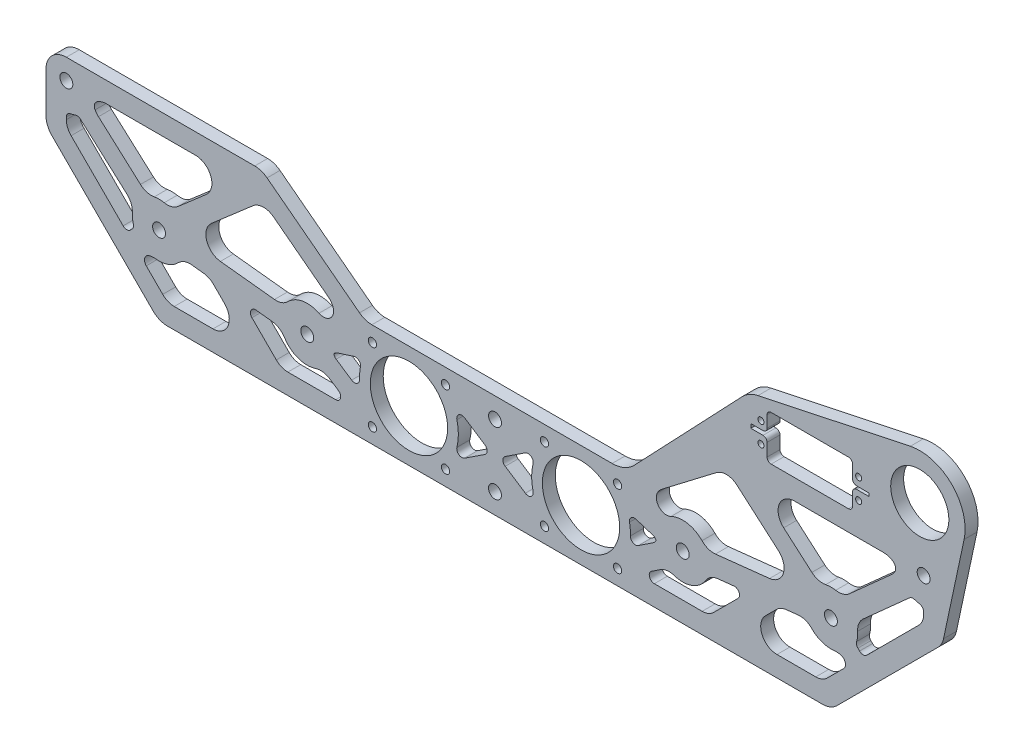
from build123d import *

# Parameters (mm, degrees)
SKETCH1_R           = 14.2875
SKETCH1_R_2         = 3.175
BOSS_EXTRUDE1_DEPTH = 6.35
FILLET1_R           = 10
CUT_EXTRUDE1_DEPTH  = 10
FILLET2_R           = 2.5
FILLET3_DEPTH       = 6.35
FILLET4_R           = 8
FILLET5_R           = 8
FILLET6_R           = 3
FILLET7_R           = 8
FILLET8_R           = 5
FILLET9_R           = 3
FILLET10_R          = 8
SKETCH3_R           = 19
CUT_EXTRUDE2_DEPTH  = 10
SKETCH4_R           = 2.032
CUT_EXTRUDE3_DEPTH  = 10
BOSS_EXTRUDE2_START = -6.35
SKETCH5_R           = 1.5
SKETCH5_R_2         = 14.2875
BOSS_EXTRUDE2_DEPTH = 6.35
FILLET11_R          = 2
FILLET12_R          = 15
SKETCH6_W           = 8
SKETCH6_H           = 1.5
SKETCH6_H_2         = 2.017189856
CUT_EXTRUDE4_DEPTH  = 10
FILLET13_R          = 2


with BuildPart() as part:
    # Sketch1 → Boss-Extrude1 (new body)
    with BuildSketch(Plane.XY):
        Polygon((-62.442934658, -37.279495554), (267.757065342, -37.279495554), (323.315335232, 18.278774336), (323.315335232, 52.320504446), (217.352871158, 52.320504446), (166.552871158, 13.520504446), (38.761259526, 13.520504446), (-12.038740474, 52.320504446), (-118.001204548, 52.320504446), (-118.001204548, 18.278774336), align=None)
        with Locations((60.373820223, -11.879495554)):
            Circle(SKETCH1_R, mode=Mode.SUBTRACT)
        with Locations((-62.442934658, 1.520504446)):
            Circle(SKETCH1_R_2, mode=Mode.SUBTRACT)
        with Locations((10.373820223, -6.424213816)):
            Circle(SKETCH1_R_2, mode=Mode.SUBTRACT)
        with Locations((102.657065342, -27.279495554)):
            Circle(SKETCH1_R_2, mode=Mode.SUBTRACT)
        with Locations((144.940310462, -11.879495554)):
            Circle(SKETCH1_R, mode=Mode.SUBTRACT)
        with Locations((194.940310462, -6.424213816)):
            Circle(SKETCH1_R_2, mode=Mode.SUBTRACT)
        with Locations((102.657065342, 3.520504446)):
            Circle(SKETCH1_R_2, mode=Mode.SUBTRACT)
        with Locations((267.757065342, 1.520504446)):
            Circle(SKETCH1_R_2, mode=Mode.SUBTRACT)
        with Locations((313.315335232, 42.320504446)):
            Circle(SKETCH1_R_2, mode=Mode.SUBTRACT)
        with Locations((-108.001204548, 42.320504446)):
            Circle(SKETCH1_R_2, mode=Mode.SUBTRACT)
    extrude(amount=BOSS_EXTRUDE1_DEPTH)

    # Fillet1
    fillet1_edges = [part.edges().sort_by_distance(p)[0] for p in [
        (-118.001204548, 18.278774336, 3.175),
        (-118.001204548, 52.320504446, 3.175),
        (-12.038740474, 52.320504446, 3.175),
        (38.761259526, 13.520504446, 3.175),
        (166.552871158, 13.520504446, 3.175),
        (217.352871158, 52.320504446, 3.175),
        (323.315335232, 52.320504446, 3.175),
        (323.315335232, 18.278774336, 3.175),
        (267.757065342, -37.279495554, 3.175),
        (-62.442934658, -37.279495554, 3.175),
    ]]
    fillet(fillet1_edges, radius=FILLET1_R)

    # Sketch2 → Cut-Extrude1 (cut)
    with BuildSketch(Plane.XY.offset(6.35)):
        with BuildLine():
            ThreePointArc((23.505920872, -7.486549706), (23.419545179, -8.265323632), (23.28702714, -9.037585605))
            Line((23.28702714, -9.037585605), (36.905820905, -18.135345959))
            ThreePointArc((36.905820905, -18.135345959), (36.127690836, -10.462503664), (37.794303215, -2.932536966))
            Line((37.794303215, -2.932536966), (23.505920872, -7.486549706))
        make_face()
        with BuildLine():
            Line((-74.858923583, 5.927753475), (-102.256554243, 30.463876853))
            ThreePointArc((-102.256554243, 30.463876853), (-105.054209768, 29.479326667), (-108.001204548, 29.145504446))
            Line((-108.001204548, 29.145504446), (-108.001204548, 22.42090996))
            Line((-108.001204548, 22.42090996), (-78.307400752, -7.272893836))
            Line((-78.307400752, -7.272893836), (-74.597651385, -3.563144469))
            ThreePointArc((-74.597651385, -3.563144469), (-75.612945288, 1.157951013), (-74.858923583, 5.927753475))
        make_face()
        with BuildLine():
            Line((-23.050139283, 42.320504446), (-94.826204548, 42.320504446))
            ThreePointArc((-94.826204548, 42.320504446), (-95.017343814, 40.084439722), (-95.585215622, 37.913255418))
            Line((-95.585215622, 37.913255418), (-68.187584962, 13.377132039))
            ThreePointArc((-68.187584962, 13.377132039), (-62.339595002, 14.695099162), (-56.512999229, 13.285558242))
            Line((-56.512999229, 13.285558242), (-23.050139283, 42.320504446))
        make_face()
        with BuildLine():
            Line((-67.526583573, -10.63421228), (-71.23633294, -14.343961648))
            Line((-71.23633294, -14.343961648), (-58.300799034, -27.279495554))
            Line((-58.300799034, -27.279495554), (-16.619224161, -27.279495554))
            Line((-16.619224161, -27.279495554), (-37.688728757, -6.209990957))
            Line((-37.688728757, -6.209990957), (-50.867789262, -4.772081195))
            ThreePointArc((-50.867789262, -4.772081195), (-58.069603335, -10.907471984), (-67.526583573, -10.63421228))
        make_face()
        with BuildLine():
            Line((30.003625706, 7.626245825), (-11.363222422, 39.221397545))
            Line((-11.363222422, 39.221397545), (-49.959338032, 5.732444651))
            ThreePointArc((-49.959338032, 5.732444651), (-49.868096719, 5.45167168), (-49.783169494, 5.168924788))
            Line((-49.783169494, 5.168924788), (-1.201325173, -0.131628174))
            ThreePointArc((-1.201325173, -0.131628174), (9.059387493, 6.685053578), (20.46921657, 2.041221648))
            Line((20.46921657, 2.041221648), (32.642653903, 5.921156225))
            ThreePointArc((32.642653903, 5.921156225), (31.289604918, 6.721797881), (30.003625706, 7.626245825))
        make_face()
        with BuildLine():
            Line((-21.814640677, -7.941943413), (-2.477088537, -27.279495554))
            Line((-2.477088537, -27.279495554), (32.591759865, -27.279495554))
            Line((32.591759865, -27.279495554), (17.732180345, -17.352853315))
            ThreePointArc((17.732180345, -17.352853315), (5.870863239, -18.805813204), (-2.285944941, -10.072634157))
            Line((-2.285944941, -10.072634157), (-21.814640677, -7.941943413))
        make_face()
        with BuildLine():
            Line((187.581950339, -17.352853315), (172.722370819, -27.279495554))
            Line((172.722370819, -27.279495554), (207.791219222, -27.279495554))
            Line((207.791219222, -27.279495554), (227.128771362, -7.941943413))
            Line((227.128771362, -7.941943413), (207.600075626, -10.072634157))
            ThreePointArc((207.600075626, -10.072634157), (199.443267446, -18.805813204), (187.581950339, -17.352853315))
        make_face()
        with BuildLine():
            Line((243.002859442, -6.209990957), (221.933354845, -27.279495554))
            Line((221.933354845, -27.279495554), (263.614929719, -27.279495554))
            Line((263.614929719, -27.279495554), (276.550463625, -14.343961648))
            Line((276.550463625, -14.343961648), (272.840714257, -10.63421228))
            ThreePointArc((272.840714257, -10.63421228), (263.38373402, -10.907471984), (256.181919946, -4.772081195))
            Line((256.181919946, -4.772081195), (243.002859442, -6.209990957))
        make_face()
        with BuildLine():
            Line((168.408309779, -18.135345959), (182.027103545, -9.037585605))
            ThreePointArc((182.027103545, -9.037585605), (181.894585505, -8.265323632), (181.808209813, -7.486549706))
            Line((181.808209813, -7.486549706), (167.519827469, -2.932536966))
            ThreePointArc((167.519827469, -2.932536966), (169.186439849, -10.462503664), (168.408309779, -18.135345959))
        make_face()
        with BuildLine():
            ThreePointArc((175.310504979, 7.626245825), (174.024525767, 6.721797881), (172.671476782, 5.921156225))
            Line((172.671476782, 5.921156225), (184.844914115, 2.041221648))
            ThreePointArc((184.844914115, 2.041221648), (196.254743191, 6.685053578), (206.515455858, -0.131628174))
            Line((206.515455858, -0.131628174), (255.097300178, 5.168924788))
            ThreePointArc((255.097300178, 5.168924788), (255.182227404, 5.45167168), (255.273468717, 5.732444651))
            Line((255.273468717, 5.732444651), (216.677353107, 39.221397545))
            Line((216.677353107, 39.221397545), (175.310504979, 7.626245825))
        make_face()
        with BuildLine():
            Line((279.911782069, -3.563144469), (283.621531436, -7.272893836))
            Line((283.621531436, -7.272893836), (313.315335232, 22.42090996))
            Line((313.315335232, 22.42090996), (313.315335232, 29.145504446))
            ThreePointArc((313.315335232, 29.145504446), (310.368340453, 29.479326667), (307.570684928, 30.463876853))
            Line((307.570684928, 30.463876853), (280.173054268, 5.927753475))
            ThreePointArc((280.173054268, 5.927753475), (280.927075973, 1.157951013), (279.911782069, -3.563144469))
        make_face()
        with BuildLine():
            Line((228.364269968, 42.320504446), (261.827129914, 13.285558242))
            ThreePointArc((261.827129914, 13.285558242), (267.653725687, 14.695099162), (273.501715647, 13.377132039))
            Line((273.501715647, 13.377132039), (300.899346307, 37.913255418))
            ThreePointArc((300.899346307, 37.913255418), (300.331474499, 40.084439722), (300.140335232, 42.320504446))
            Line((300.140335232, 42.320504446), (228.364269968, 42.320504446))
        make_face()
        with BuildLine():
            Line((124.499254422, 1.237130698), (104.481636284, -11.879495554))
            Line((104.481636284, -11.879495554), (124.499254422, -24.996121805))
            ThreePointArc((124.499254422, -24.996121805), (120.652810462, -11.879495554), (124.499254422, 1.237130698))
        make_face()
        with BuildLine():
            Line((100.832494401, -11.879495554), (80.814876263, 1.237130698))
            ThreePointArc((80.814876263, 1.237130698), (84.661320223, -11.879495554), (80.814876263, -24.996121805))
            Line((80.814876263, -24.996121805), (100.832494401, -11.879495554))
        make_face()
    extrude(amount=-CUT_EXTRUDE1_DEPTH, mode=Mode.SUBTRACT)

    # Fillet2
    # the kernel refuses this fillet: 2.5 mm, written as the material it adds along each edge
    with BuildSketch(Plane(origin=(124.499254422, -24.996121805, 6.35), x_dir=(-0.8364298099761919, 0.5480740579366914, 0), z_dir=(0, 0, -1)), Plane(origin=(80.814876263, 1.237130698, 6.35), x_dir=(0.8364298099761912, -0.5480740579366923, 0), z_dir=(0, 0, -1))) as fillet2_piece_1:
        with BuildLine():
            CenterArc((8.270761151, 2.5), FILLET2_R, 132.738385679, 137.261614321)
            ThreePointArc((6.574131455, 4.336150232), (3.463988922, 1.899838021), (0, 0))
            Line((0, 0), (8.270761151, 0))
        make_face()
    extrude(amount=6.35)
    with BuildSketch(Plane(origin=(104.481636284, -11.879495554, 6.35), x_dir=(0.836429809976191, 0.5480740579366925, 0), z_dir=(0, 0, -1)), Plane(origin=(100.832494401, -11.879495554, 6.35), x_dir=(-0.836429809976192, -0.5480740579366911, 0), z_dir=(0, 0, -1))) as fillet2_piece_2:
        with BuildLine():
            CenterArc((FILLET2_R * 1.52612552604, FILLET2_R), FILLET2_R, 156.469970738, 113.530029262)
            Line((FILLET2_R * 0.609274565772, FILLET2_R * 1.39922965403), (0, 0))
            Line((0, 0), (FILLET2_R * 1.52612552604, 0))
        make_face()
    extrude(amount=6.35)
    with BuildSketch(Plane(origin=(124.499254422, 1.237130698, 6.35), x_dir=(-0.8364298099761911, -0.5480740579366926, 0), z_dir=(0, 0, -1)), Plane(origin=(80.814876263, -24.996121805, 6.35), x_dir=(0.8364298099761913, 0.5480740579366921, 0), z_dir=(0, 0, -1))) as fillet2_piece_3:
        with BuildLine():
            CenterArc((8.270761151, -2.5), FILLET2_R, 90, 137.261614321)
            ThreePointArc((6.574131455, -4.336150232), (3.463988922, -1.899838021), (0, 0))
            Line((0, 0), (8.270761151, 0))
        make_face()
    extrude(amount=6.35)
    with BuildSketch(Plane(origin=(36.905820905, -18.135345959, 6.35), x_dir=(-0.8315267709778132, 0.5554846794891928, 0), z_dir=(0, 0, -1))) as fillet2_piece_4:
        with BuildLine():
            CenterArc((5.637586761, 2.5), FILLET2_R, 144.019234869, 125.980765131)
            ThreePointArc((3.614551073, 3.968784057), (1.917261006, 1.884223289), (0, 0))
            Line((0, 0), (5.637586761, 0))
        make_face()
    extrude(amount=6.35)
    with BuildSketch(Plane(origin=(37.794303215, -2.932536966, 6.35), x_dir=(-0.9527771354410546, -0.3036704302047504, 0), z_dir=(0, 0, -1))) as fillet2_piece_5:
        with BuildLine():
            CenterArc((4.690805929, -2.5), FILLET2_R, 90, 118.741955759)
            ThreePointArc((2.498820236, -3.702164183), (1.334695889, -1.793517434), (0, 0))
            Line((0, 0), (4.690805929, 0))
        make_face()
    extrude(amount=6.35)
    with BuildSketch(Plane(origin=(23.28702714, -9.037585605, 6.35), x_dir=(0.14435302535723496, 0.989526252340085, 0), z_dir=(0, 0, -1)), Plane(origin=(181.808209813, -7.486549706, 6.35), x_dir=(0.13512930422682767, -0.9908279725255911, 0), z_dir=(0, 0, -1)), Plane(origin=(307.570684928, 30.463876853, 6.35), x_dir=(0.9224742738611128, -0.3860585629984297, 0), z_dir=(0, 0, -1))) as fillet2_piece_6:
        with BuildLine():
            CenterArc((1.580869434, 2.496243903), FILLET2_R, 205.444288667, 61.414548907)
            Line((-0.676639225, 1.422160733), (0, 0))
            ThreePointArc((0, 0), (0.721939507, 0.019794629), (1.443879015, 0))
        make_face()
    extrude(amount=6.35)
    with BuildSketch(Plane(origin=(23.505920872, -7.486549706, 6.35), x_dir=(0.9527771354410546, 0.3036704302047506, 0), z_dir=(0, 0, -1)), Plane(origin=(182.027103545, -9.037585605, 6.35), x_dir=(-0.8315267709778119, -0.5554846794891947, 0), z_dir=(0, 0, -1)), Plane(origin=(-74.597651385, -3.563144469, 6.35), x_dir=(-0.7071067811865465, -0.7071067811865487, 0), z_dir=(0, 0, -1)), Plane(origin=(-102.256554243, 30.463876853, 6.35), x_dir=(0.7449378564648427, -0.667133862133804, 0), z_dir=(0, 0, -1))) as fillet2_piece_7:
        with BuildLine():
            CenterArc((1.574922789, 2.5), FILLET2_R, 208.585451093, 61.414548907)
            ThreePointArc((-0.62033846, 1.303827751), (-0.292294611, 0.660418307), (0, 0))
            Line((0, 0), (1.574922789, 0))
        make_face()
    extrude(amount=6.35)
    with BuildSketch(Plane(origin=(168.408309779, -18.135345959, 6.35), x_dir=(0.8315267709778126, 0.555484679489194, 0), z_dir=(0, 0, -1))) as fillet2_piece_8:
        with BuildLine():
            CenterArc((5.637586761, -2.5), FILLET2_R, 90, 125.980765131)
            ThreePointArc((3.614551073, -3.968784057), (1.917261006, -1.884223289), (0, 0))
            Line((0, 0), (5.637586761, 0))
        make_face()
    extrude(amount=6.35)
    with BuildSketch(Plane(origin=(167.519827469, -2.932536966, 6.35), x_dir=(0.9527771354410542, -0.3036704302047514, 0), z_dir=(0, 0, -1))) as fillet2_piece_9:
        with BuildLine():
            CenterArc((4.690805929, 2.5), FILLET2_R, 151.258044241, 118.741955759)
            ThreePointArc((2.498820236, 3.702164183), (1.334695889, 1.793517434), (0, 0))
            Line((0, 0), (4.690805929, 0))
        make_face()
    extrude(amount=6.35)
    with BuildSketch(Plane(origin=(-21.814640677, -7.941943413, 6.35), x_dir=(0.9941005983250841, -0.10846197679237511, 0), z_dir=(0, 0, -1)), Plane(origin=(227.128771362, -7.941943413, 6.35), x_dir=(-0.7071067811865478, -0.7071067811865472, 0), z_dir=(0, 0, -1))) as fillet2_piece_10:
        with BuildLine():
            CenterArc((FILLET2_R * 2.8417642098, FILLET2_R), FILLET2_R, 128.773337141, 141.226662859)
            Line((FILLET2_R * 2.21552313484, FILLET2_R * 1.77962947355), (0, 0))
            Line((0, 0), (FILLET2_R * 2.8417642098, 0))
        make_face()
    extrude(amount=6.35)
    with BuildSketch(Plane(origin=(32.591759865, -27.279495554, 6.35), x_dir=(-1, 0, 0), z_dir=(0, 0, -1)), Plane(origin=(172.722370819, -27.279495554, 6.35), x_dir=(0.8315267709778129, 0.5554846794891936, 0), z_dir=(0, 0, -1))) as fillet2_piece_11:
        with BuildLine():
            CenterArc((FILLET2_R * 3.2971688304, FILLET2_R), FILLET2_R, 123.74410479, 146.25589521)
            Line((FILLET2_R * 2.74168415091, FILLET2_R * 1.83152677098), (0, 0))
            Line((0, 0), (FILLET2_R * 3.2971688304, 0))
        make_face()
    extrude(amount=6.35)
    with BuildSketch(Plane(origin=(279.911782069, -3.563144469, 6.35), x_dir=(0.7071067811865567, -0.7071067811865384, 0), z_dir=(0, 0, -1))) as fillet2_piece_12:
        with BuildLine():
            CenterArc((1.574922789, -2.5), FILLET2_R, 90, 61.414548907)
            ThreePointArc((-0.62033846, -1.303827751), (-0.292294611, -0.660418307), (0, 0))
            Line((0, 0), (1.574922789, 0))
        make_face()
    extrude(amount=6.35)
    with BuildSketch(Plane(origin=(283.621531436, -7.272893836, 6.35), x_dir=(-0.707106781186556, 0.7071067811865389, 0), z_dir=(0, 0, -1))) as fillet2_piece_13:
        with BuildLine():
            CenterArc((FILLET2_R, FILLET2_R), FILLET2_R, 180, 90)
            Line((0, FILLET2_R), (0, 0))
            Line((0, 0), (FILLET2_R, 0))
        make_face()
    extrude(amount=6.35)
    with BuildSketch(Plane(origin=(-78.307400752, -7.272893836, 6.35), x_dir=(0.7071067811865476, 0.7071067811865476, 0), z_dir=(0, 0, -1))) as fillet2_piece_14:
        with BuildLine():
            CenterArc((FILLET2_R, -FILLET2_R), FILLET2_R, 90, 90)
            Line((0, -FILLET2_R), (0, 0))
            Line((0, 0), (FILLET2_R, 0))
        make_face()
    extrude(amount=6.35)
    with BuildSketch(Plane(origin=(-108.001204548, 29.145504446, 6.35), x_dir=(0.996794764075885, 0.08000123943352926, 0), z_dir=(0, 0, -1))) as fillet2_piece_15:
        with BuildLine():
            CenterArc((2.308035758, 2.49198691), FILLET2_R, 184.588636978, 80.822726043)
            Line((-0.183951153, 2.291983812), (0, 0))
            ThreePointArc((0, 0), (1.05401633, 0.042228983), (2.108032659, 0))
        make_face()
    extrude(amount=6.35)
    with BuildSketch(Plane(origin=(313.315335232, 29.145504446, 6.35), x_dir=(0, -1, 0), z_dir=(0, 0, -1))) as fillet2_piece_16:
        with BuildLine():
            CenterArc((2.299353783, 2.5), FILLET2_R, 189.177273957, 80.822726043)
            ThreePointArc((-0.168645225, 2.101275917), (-0.042228983, 1.05401633), (0, 0))
            Line((0, 0), (2.299353783, 0))
        make_face()
    extrude(amount=6.35)

    # Fillet3: read off the stored shape, not the designer's step
    # Fillet3 outline → Fillet3 (add)
    with BuildSketch(Plane.XY):
        with BuildLine():
            ThreePointArc((211.014076866, 0.359196726), (207.431725827, 0.786667832), (204.401466543, 2.744600208))
            ThreePointArc((204.401466543, 2.744600208), (205.556320418, 1.37841123), (206.515455858, -0.131628174))
            Line((206.515455858, -0.131628174), (211.014076866, 0.359196726))
        make_face()
        with BuildLine():
            Line((172.671476782, 5.921156225), (184.844914115, 2.041221648))
            ThreePointArc((184.844914115, 2.041221648), (181.600857992, 8.411550009), (184.744728864, 14.831912887))
            Line((184.744728864, 14.831912887), (175.310504979, 7.626245825))
            ThreePointArc((175.310504979, 7.626245825), (174.024525767, 6.721797881), (172.671476782, 5.921156225))
        make_face()
        with BuildLine():
            ThreePointArc((253.267424296, 7.473042793), (254.289203208, 6.405834356), (255.097300178, 5.168924788))
            ThreePointArc((255.097300178, 5.168924788), (255.182227404, 5.45167168), (255.273468717, 5.732444651))
            Line((255.273468717, 5.732444651), (253.267424296, 7.473042793))
        make_face()
        with BuildLine():
            Line((216.677353107, 39.221397545), (211.499590999, 35.266728848))
            ThreePointArc((211.499590999, 35.266728848), (216.60505587, 36.90513128), (221.598403693, 34.951516272))
            Line((221.598403693, 34.951516272), (216.677353107, 39.221397545))
        make_face()
        with BuildLine():
            ThreePointArc((0.912664141, 2.744600208), (-2.117595142, 0.786667832), (-5.699946181, 0.359196726))
            Line((-5.699946181, 0.359196726), (-1.201325173, -0.131628174))
            ThreePointArc((-1.201325173, -0.131628174), (-0.242189733, 1.37841123), (0.912664141, 2.744600208))
        make_face()
        with BuildLine():
            ThreePointArc((-49.959338032, 5.732444651), (-49.868096719, 5.45167168), (-49.783169494, 5.168924788))
            ThreePointArc((-49.783169494, 5.168924788), (-48.975072523, 6.405834356), (-47.953293611, 7.473042793))
            Line((-47.953293611, 7.473042793), (-49.959338032, 5.732444651))
        make_face()
        with BuildLine():
            ThreePointArc((20.56940182, 14.831912887), (23.713272692, 8.411550009), (20.46921657, 2.041221648))
            Line((20.46921657, 2.041221648), (32.642653903, 5.921156225))
            ThreePointArc((32.642653903, 5.921156225), (31.289604918, 6.721797881), (30.003625706, 7.626245825))
            Line((30.003625706, 7.626245825), (20.56940182, 14.831912887))
        make_face()
        with BuildLine():
            Line((-11.363222422, 39.221397545), (-16.284273008, 34.951516272))
            ThreePointArc((-16.284273008, 34.951516272), (-11.290925185, 36.90513128), (-6.185460314, 35.266728848))
            Line((-6.185460314, 35.266728848), (-11.363222422, 39.221397545))
        make_face()
        with BuildLine():
            Line((-58.300799034, -27.279495554), (-54.987090535, -27.279495554))
            ThreePointArc((-54.987090535, -27.279495554), (-58.048557994, -26.670531814), (-60.643944784, -24.936349803))
            Line((-60.643944784, -24.936349803), (-58.300799034, -27.279495554))
        make_face()
        with BuildLine():
            ThreePointArc((-30.27607841, -13.622641304), (-28.5418964, -22.340963013), (-35.93293266, -27.279495554))
            Line((-35.93293266, -27.279495554), (-16.619224161, -27.279495554))
            Line((-16.619224161, -27.279495554), (-30.27607841, -13.622641304))
        make_face()
        with BuildLine():
            Line((-67.526583573, -10.63421228), (-70.726466387, -13.834095095))
            ThreePointArc((-70.726466387, -13.834095095), (-67.665859968, -11.923948803), (-64.077242842, -11.552737759))
            ThreePointArc((-64.077242842, -11.552737759), (-65.833164615, -11.210833497), (-67.526583573, -10.63421228))
        make_face()
        with BuildLine():
            ThreePointArc((-52.981778576, -7.648309578), (-49.951519293, -5.690377201), (-46.369168254, -5.262906096))
            Line((-46.369168254, -5.262906096), (-50.867789262, -4.772081195))
            ThreePointArc((-50.867789262, -4.772081195), (-51.826924702, -6.2821206), (-52.981778576, -7.648309578))
        make_face()
        with BuildLine():
            Line((221.933354845, -27.279495554), (241.247063344, -27.279495554))
            ThreePointArc((241.247063344, -27.279495554), (233.856027084, -22.340963013), (235.590209095, -13.622641304))
            Line((235.590209095, -13.622641304), (221.933354845, -27.279495554))
        make_face()
        with BuildLine():
            Line((256.181919946, -4.772081195), (251.683298938, -5.262906096))
            ThreePointArc((251.683298938, -5.262906096), (255.265649978, -5.690377201), (258.295909261, -7.648309578))
            ThreePointArc((258.295909261, -7.648309578), (257.141055386, -6.2821206), (256.181919946, -4.772081195))
        make_face()
        with BuildLine():
            ThreePointArc((269.391373527, -11.552737759), (272.979990652, -11.923948803), (276.040597072, -13.834095095))
            Line((276.040597072, -13.834095095), (272.840714257, -10.63421228))
            ThreePointArc((272.840714257, -10.63421228), (271.147295299, -11.210833497), (269.391373527, -11.552737759))
        make_face()
        with BuildLine():
            Line((313.315335232, 22.42090996), (313.315335232, 25.734618459))
            ThreePointArc((313.315335232, 25.734618459), (312.706371492, 22.673151), (310.972189482, 20.077764209))
            Line((310.972189482, 20.077764209), (313.315335232, 22.42090996))
        make_face()
        with BuildLine():
            Line((-108.001204548, 22.42090996), (-105.658058797, 20.077764209))
            ThreePointArc((-105.658058797, 20.077764209), (-107.392240808, 22.673151), (-108.001204548, 25.734618459))
            Line((-108.001204548, 25.734618459), (-108.001204548, 22.42090996))
        make_face()
        with BuildLine():
            ThreePointArc((-94.710843669, 39.231452318), (-91.910717066, 41.506865938), (-88.395577167, 42.320504446))
            Line((-88.395577167, 42.320504446), (-94.826204548, 42.320504446))
            ThreePointArc((-94.826204548, 42.320504446), (-95.017343814, 40.084439722), (-95.585215622, 37.913255418))
            Line((-95.585215622, 37.913255418), (-92.214135174, 34.89426276))
            ThreePointArc((-92.214135174, 34.89426276), (-93.810362745, 36.862603833), (-94.710843669, 39.231452318))
        make_face()
        with BuildLine():
            Line((-23.050139283, 42.320504446), (-44.477079813, 42.320504446))
            ThreePointArc((-44.477079813, 42.320504446), (-36.98241748, 37.118724686), (-39.234150855, 28.278013574))
            Line((-39.234150855, 28.278013574), (-23.050139283, 42.320504446))
        make_face()
        with BuildLine():
            ThreePointArc((-64.794001652, 14.484034405), (-68.39760622, 14.657252847), (-71.55866541, 16.396124697))
            Line((-71.55866541, 16.396124697), (-68.187584962, 13.377132039))
            ThreePointArc((-68.187584962, 13.377132039), (-66.528453946, 14.04604464), (-64.794001652, 14.484034405))
        make_face()
        with BuildLine():
            Line((-56.512999229, 13.285558242), (-53.094975386, 16.251298127))
            ThreePointArc((-53.094975386, 16.251298127), (-56.282922876, 14.562226986), (-59.888801275, 14.445558708))
            ThreePointArc((-59.888801275, 14.445558708), (-58.161433032, 13.980414913), (-56.512999229, 13.285558242))
        make_face()
        with BuildLine():
            ThreePointArc((300.024974354, 39.231452318), (299.12449343, 36.862603833), (297.528265858, 34.89426276))
            Line((297.528265858, 34.89426276), (300.899346307, 37.913255418))
            ThreePointArc((300.899346307, 37.913255418), (300.331474499, 40.084439722), (300.140335232, 42.320504446))
            Line((300.140335232, 42.320504446), (293.709707851, 42.320504446))
            ThreePointArc((293.709707851, 42.320504446), (297.224847751, 41.506865938), (300.024974354, 39.231452318))
        make_face()
        with BuildLine():
            Line((273.501715647, 13.377132039), (276.872796095, 16.396124697))
            ThreePointArc((276.872796095, 16.396124697), (273.711736905, 14.657252847), (270.108132336, 14.484034405))
            ThreePointArc((270.108132336, 14.484034405), (271.842584631, 14.04604464), (273.501715647, 13.377132039))
        make_face()
        with BuildLine():
            ThreePointArc((244.54828154, 28.278013574), (242.296548164, 37.118724686), (249.791210497, 42.320504446))
            Line((249.791210497, 42.320504446), (228.364269968, 42.320504446))
            Line((228.364269968, 42.320504446), (244.54828154, 28.278013574))
        make_face()
        with BuildLine():
            ThreePointArc((261.827129914, 13.285558242), (263.475563717, 13.980414913), (265.202931959, 14.445558708))
            ThreePointArc((265.202931959, 14.445558708), (261.59705356, 14.562226986), (258.409106071, 16.251298127))
            Line((258.409106071, 16.251298127), (261.827129914, 13.285558242))
        make_face()
        with BuildLine():
            ThreePointArc((280.900420623, 2.433103461), (281.468499861, 5.995863135), (283.544134716, 8.946746132))
            Line((283.544134716, 8.946746132), (280.173054268, 5.927753475))
            ThreePointArc((280.173054268, 5.927753475), (280.655637502, 4.205175982), (280.900420623, 2.433103461))
        make_face()
        with BuildLine():
            ThreePointArc((183.819027546, -19.866597953), (187.193607633, -18.590596485), (190.785655576, -18.926992218))
            ThreePointArc((190.785655576, -18.926992218), (189.130245318, -18.248923877), (187.581950339, -17.352853315))
            Line((187.581950339, -17.352853315), (183.819027546, -19.866597953))
        make_face()
        with BuildLine():
            ThreePointArc((206.156066314, -13.337060238), (208.692812831, -10.771736161), (212.098696634, -9.581809257))
            Line((212.098696634, -9.581809257), (207.600075626, -10.072634157))
            ThreePointArc((207.600075626, -10.072634157), (206.989138013, -11.753977379), (206.156066314, -13.337060238))
        make_face()
        with BuildLine():
            ThreePointArc((-6.784565949, -9.581809257), (-3.378682147, -10.771736161), (-0.84193563, -13.337060238))
            ThreePointArc((-0.84193563, -13.337060238), (-1.675007328, -11.753977378), (-2.285944941, -10.072634157))
            Line((-2.285944941, -10.072634157), (-6.784565949, -9.581809257))
        make_face()
        with BuildLine():
            ThreePointArc((17.732180345, -17.352853315), (16.183885366, -18.248923877), (14.528475108, -18.926992218))
            ThreePointArc((14.528475108, -18.926992218), (18.120523051, -18.590596485), (21.495103139, -19.866597953))
            Line((21.495103139, -19.866597953), (17.732180345, -17.352853315))
        make_face()
        with BuildLine():
            ThreePointArc((-78.230004032, 8.946746132), (-76.154369176, 5.995863135), (-75.586289939, 2.433103461))
            ThreePointArc((-75.586289939, 2.433103461), (-75.341506817, 4.205175982), (-74.858923583, 5.927753475))
            Line((-74.858923583, 5.927753475), (-78.230004032, 8.946746132))
        make_face()
    extrude(amount=FILLET3_DEPTH)

    # Fillet4
    fillet4_edges = [part.edges().sort_by_distance(p)[0] for p in [
        (-49.783169494, 5.168924788, 3.175),
        (255.097300178, 5.168924788, 3.175),
    ]]
    fillet(fillet4_edges, radius=FILLET4_R)

    # Fillet5
    # the kernel refuses this fillet: 8 mm, written as the material it adds along each edge
    with BuildSketch(Plane(origin=(276.550463625, -14.343961648, 6.35), x_dir=(-0.7071067811865465, -0.7071067811865486, 0), z_dir=(0, 0, -1))) as fillet5_piece_1:
        with BuildLine():
            CenterArc((3.319191964, 8), FILLET5_R, 245.487044087, 24.512955913)
            Line((0, 0.721060194), (-0.066383839, 0.575481398))
            ThreePointArc((-0.066383839, 0.575481398), (-0.16, 0.360530097), (-0.16, 0))
            Line((-0.16, 0), (0, -0.16))
            Line((0, -0.16), (3.319191964, -0.16))
            Line((3.319191964, -0.16), (3.319191964, 0))
        make_face()
    extrude(amount=6.35)
    with BuildSketch(Plane(origin=(-71.23633294, -14.343961648, 6.35), x_dir=(0.7071067811865467, -0.7071067811865483, 0), z_dir=(0, 0, -1))) as fillet5_piece_2:
        with BuildLine():
            CenterArc((3.319191965, -8), FILLET5_R, 90, 24.512955918)
            Line((0, -0.721060194), (-0.066383839, -0.575481398))
            ThreePointArc((-0.066383839, -0.575481398), (-0.16, -0.360530097), (-0.16, 0))
            Line((-0.16, 0), (0, 0.16))
            Line((0, 0.16), (3.319191965, 0.16))
            Line((3.319191965, 0.16), (3.319191965, 0))
        make_face()
    extrude(amount=6.35)

    # Fillet6
    fillet6_edges = [part.edges().sort_by_distance(p)[0] for p in [
        (276.040597072, -13.834095095, 3.175),
        (-70.726466387, -13.834095095, 3.175),
    ]]
    fillet(fillet6_edges, radius=FILLET6_R)

    # Fillet7
    fillet7_edges = [part.edges().sort_by_distance(p)[0] for p in [
        (-2.477088537, -27.279495554, 3.175),
        (207.791219222, -27.279495554, 3.175),
        (263.614929719, -27.279495554, 3.175),
    ]]
    fillet(fillet7_edges, radius=FILLET7_R)

    # Fillet8
    fillet8_edges = [part.edges().sort_by_distance(p)[0] for p in [
        (184.844914115, 2.041221648, 3.175),
        (20.46921657, 2.041221648, 3.175),
    ]]
    fillet(fillet8_edges, radius=FILLET8_R)

    # Fillet9
    fillet9_edges = [part.edges().sort_by_distance(p)[0] for p in [
        (-94.710843669, 39.231452318, 3.175),
        (300.024974354, 39.231452318, 3.175),
    ]]
    fillet(fillet9_edges, radius=FILLET9_R)

    # Fillet10
    fillet10_edges = [part.edges().sort_by_distance(p)[0] for p in [
        (-37.688728757, -6.209990957, 3.175),
        (243.002859442, -6.209990957, 3.175),
    ]]
    fillet(fillet10_edges, radius=FILLET10_R)

    # Sketch3 → Cut-Extrude2 (cut)
    with BuildSketch(Plane(origin=(0, 0, 0), x_dir=(-1, 0, 0), z_dir=(0, 0, -1))):
        with Locations((-144.940310462, -11.879495554)):
            Circle(SKETCH3_R)
        with Locations((-60.373820223, -11.879495554)):
            Circle(SKETCH3_R)
    extrude(amount=-CUT_EXTRUDE2_DEPTH, mode=Mode.SUBTRACT)

    # Sketch4 → Cut-Extrude3 (cut)
    with BuildSketch(Plane(origin=(0, 0, 0), x_dir=(-1, 0, 0), z_dir=(0, 0, -1))):
        with Locations((-126.97979822, 6.081016689)):
            Circle(SKETCH4_R)
        with Locations((-42.413307981, 6.081016689)):
            Circle(SKETCH4_R)
        with Locations((-126.97979822, -29.840007796)):
            Circle(SKETCH4_R)
        with Locations((-162.900822704, -29.840007796)):
            Circle(SKETCH4_R)
        with Locations((-162.900822704, 6.081016689)):
            Circle(SKETCH4_R)
        with Locations((-42.413307981, -29.840007796)):
            Circle(SKETCH4_R)
        with Locations((-78.334332465, -29.840007796)):
            Circle(SKETCH4_R)
        with Locations((-78.334332465, 6.081016689)):
            Circle(SKETCH4_R)
    extrude(amount=-CUT_EXTRUDE3_DEPTH, mode=Mode.SUBTRACT)

    # Sketch5 → Boss-Extrude2 (add)
    with BuildSketch(Plane(origin=(0, 0, 0), x_dir=(-1, 0, 0), z_dir=(0, 0, -1)).offset(BOSS_EXTRUDE2_START)):
        with BuildLine():
            Line((-227.385540081, 77.320504446), (-306.80604964, 94.125237679))
            ThreePointArc((-306.80604964, 94.125237679), (-327.196205804, 88.063319138), (-333.214589736, 67.660270845))
            Line((-333.214589736, 67.660270845), (-323.094285793, 20.329947043))
            ThreePointArc((-323.094285793, 20.329947043), (-323.259919326, 21.369602586), (-323.315335232, 22.42090996))
            Line((-323.315335232, 22.42090996), (-323.315335232, 42.320504446))
            ThreePointArc((-323.315335232, 42.320504446), (-320.386403044, 49.391572258), (-313.315335232, 52.320504446))
            Line((-313.315335232, 52.320504446), (-278.385540081, 52.320504446))
            Line((-278.385540081, 52.320504446), (-278.385540081, 74.320504446))
            Line((-278.385540081, 74.320504446), (-236.385540081, 74.320504446))
            Line((-236.385540081, 74.320504446), (-236.385540081, 52.320504446))
            Line((-236.385540081, 52.320504446), (-220.734946679, 52.320504446))
            ThreePointArc((-220.734946679, 52.320504446), (-217.531143712, 51.793394531), (-214.665092008, 50.267633757))
            Line((-214.665092008, 50.267633757), (-169.240650308, 15.573375136))
            ThreePointArc((-169.240650308, 15.573375136), (-168.489017723, 15.051944129), (-167.692880031, 14.601381578))
            Line((-167.692880031, 14.601381578), (-227.385540081, 77.320504446))
        make_face()
        with Locations((-281.385540081, 58.320504446)):
            Circle(SKETCH5_R, mode=Mode.SUBTRACT)
        with Locations((-281.385540081, 68.320504446)):
            Circle(SKETCH5_R, mode=Mode.SUBTRACT)
        with Locations((-233.385540081, 68.320504446)):
            Circle(SKETCH5_R, mode=Mode.SUBTRACT)
        with Locations((-233.385540081, 58.320504446)):
            Circle(SKETCH5_R, mode=Mode.SUBTRACT)
        with Locations((-311.419753672, 72.320504446)):
            Circle(SKETCH5_R_2, mode=Mode.SUBTRACT)
    extrude(amount=BOSS_EXTRUDE2_DEPTH)

    # Fillet11
    fillet11_edges = [part.edges().sort_by_distance(p)[0] for p in [
        (236.385540081, 52.320504446, 3.175),
        (236.385540081, 74.320504446, 3.175),
        (278.385540081, 74.320504446, 3.175),
        (278.385540081, 52.320504446, 3.175),
    ]]
    fillet(fillet11_edges, radius=FILLET11_R)

    # Fillet12
    fillet12_edges = [part.edges().sort_by_distance(p)[0] for p in [
        (227.385540081, 77.320504446, 3.175),
        (167.692880031, 14.601381578, 3.175),
    ]]
    fillet(fillet12_edges, radius=FILLET12_R)

    # Sketch6 → Cut-Extrude4 (cut)
    with BuildSketch(Plane(origin=(0, 0, 0), x_dir=(-1, 0, 0), z_dir=(0, 0, -1))):
        with Locations((-282.385540081, 63.320504446)):
            Rectangle(SKETCH6_W, SKETCH6_H)
        with Locations((-232.385540081, 63.579099374)):
            Rectangle(SKETCH6_W, SKETCH6_H_2)
    extrude(amount=-CUT_EXTRUDE4_DEPTH, mode=Mode.SUBTRACT)

    # Fillet13
    fillet13_edges = [part.edges().sort_by_distance(p)[0] for p in [
        (278.385540081, 64.070504446, 3.175),
        (278.385540081, 62.570504446, 3.175),
        (236.385540081, 64.587694302, 3.175),
        (236.385540081, 62.570504446, 3.175),
    ]]
    fillet(fillet13_edges, radius=FILLET13_R)


solid = part.part
